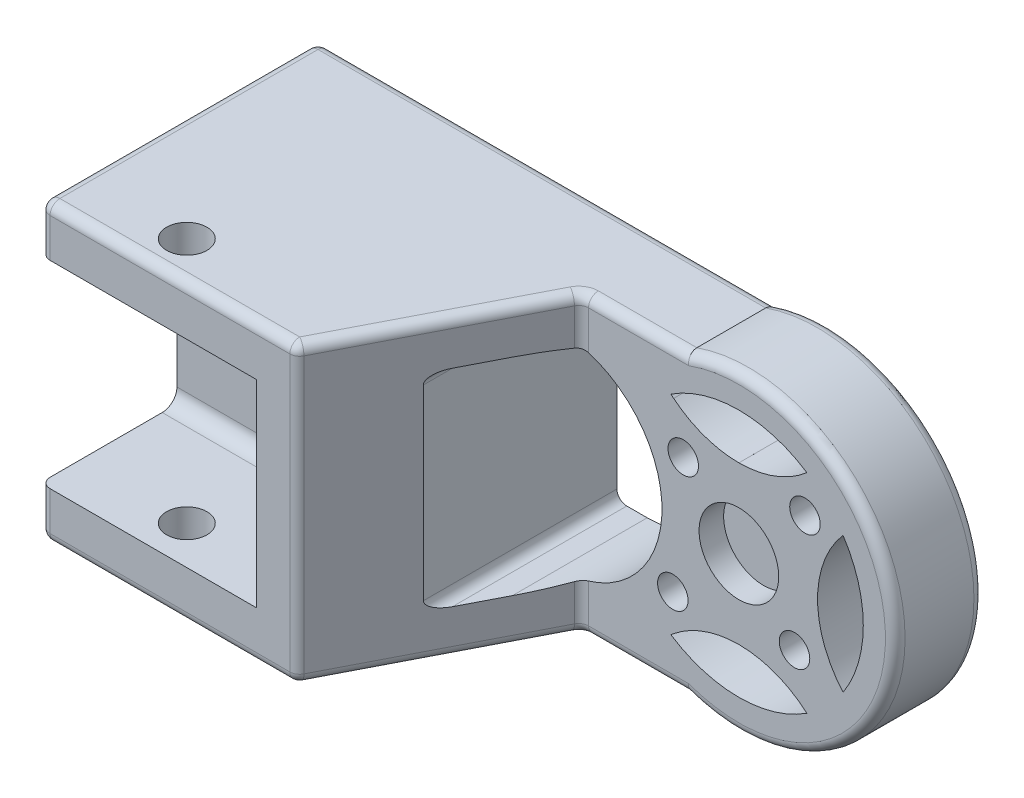
from build123d import *

# Parameters (mm, degrees)
ESQUISSE4_R                   = 13.9
ESQUISSE4_R_2                 = 1.55
BOSS_EXTRU_3_DEPTH            = 4.5
ESQUISSE7_R                   = 15.9
ESQUISSE7_R_2                 = 13.9
BOSS_EXTRU_7_DEPTH            = 9
BOSS_EXTRU_8_DEPTH            = 30
ENL_V_START                   = -4.5
ENL_V_MAT_EXTRU_12_OUTLINE_R  = 1.55
ENL_V_MAT_EXTRU_12_DEPTH      = 9
TROU_TARAUD_M32_D             = 2.5
TROU_TARAUD_M32_DEPTH         = 36
TROU_TARAUD_M32_CSINK_D       = 3.5
TROU_TARAUD_M32_CSINK_ANGLE   = 90
ENL_V_MAT_EXTRU_1_DEPTH       = 22
ESQUISSE13_R                  = 2.05
ENL_V_MAT_EXTRU_4_DEPTH       = 69.045108798
ESQUISSE15_R                  = 2.05
ENL_V_MAT_EXTRU_5_DEPTH       = 66.052954056
ENL_V_MAT_EXTRU_6_DEPTH       = 77.342234353
ESQUISSE24_R                  = 4.05
ENL_V_MAT_EXTRU_9_DEPTH       = 2.5
TROU_TARAUD_M33_D             = 2.5
TROU_TARAUD_M33_DEPTH         = 28.24245014
TROU_TARAUD_M33_CSINK_D       = 3.5
TROU_TARAUD_M33_CSINK_ANGLE   = 90
CONG_2_R                      = 1
ENL_V_MAT_EXTRU_13_DEPTH      = 58.499206362
ENL_V_MAT_EXTRU_13_DEPTH_BACK = 58.499206362
CONG_3_R                      = 1
CONG_4_R                      = 1


# Read off the part's stored shape, not the designer's step: Enlèv. mat.-Extru.12
with BuildPart() as part:
    # Esquisse4 → Boss.-Extru.3 (new, symmetric)
    with BuildSketch(Plane.XY):
        Circle(ESQUISSE4_R)
        with Locations((-6.717514421, -6.717514421)):
            Circle(ESQUISSE4_R_2, mode=Mode.SUBTRACT)
        with Locations((6.717514421, 6.717514421)):
            Circle(ESQUISSE4_R_2, mode=Mode.SUBTRACT)
        with Locations((-5.656854249, 5.656854249)):
            Circle(ESQUISSE4_R_2, mode=Mode.SUBTRACT)
        with Locations((5.656854249, -5.656854249)):
            Circle(ESQUISSE4_R_2, mode=Mode.SUBTRACT)
        with BuildLine():
            ThreePointArc((-10.594734512, 6.911881121), (-12.65, 0), (-10.594734512, -6.911881121))
            ThreePointArc((-10.594734512, -6.911881121), (-7.999175124, 0), (-10.594734512, 6.911881121))
        make_face(mode=Mode.SUBTRACT)
        with BuildLine():
            ThreePointArc((6.911881121, -10.594734512), (0, -7.999175124), (-6.911881121, -10.594734512))
            ThreePointArc((-6.911881121, -10.594734512), (0, -12.65), (6.911881121, -10.594734512))
        make_face(mode=Mode.SUBTRACT)
        with BuildLine():
            ThreePointArc((-6.911881121, 10.594734512), (0, 7.999175124), (6.911881121, 10.594734512))
            ThreePointArc((6.911881121, 10.594734512), (0, 12.65), (-6.911881121, 10.594734512))
        make_face(mode=Mode.SUBTRACT)
        with BuildLine():
            ThreePointArc((10.594734512, 6.911881121), (7.999175124, 0), (10.594734512, -6.911881121))
            ThreePointArc((10.594734512, -6.911881121), (12.65, 0), (10.594734512, 6.911881121))
        make_face(mode=Mode.SUBTRACT)
    extrude(amount=BOSS_EXTRU_3_DEPTH, both=True)

    # Esquisse7 → Boss.-Extru.7 (add)
    with BuildSketch(Plane.XY.offset(4.5)):
        Circle(ESQUISSE7_R)
        Circle(ESQUISSE7_R_2, mode=Mode.SUBTRACT)
    extrude(amount=-BOSS_EXTRU_7_DEPTH)

    # Esquisse6 → Boss.-Extru.8 (add)
    with BuildSketch(Plane(origin=(0, -15, 0), x_dir=(1, 0, 0), z_dir=(0, 1, 0))):
        Polygon((-51.798424989, -31.5), (-29.798424989, -31.5), (-15.9, -4.5), (0, -4.5), (0, 4.5), (-15.9, 4.5), (-51.798424989, 4.5), align=None)
    extrude(amount=BOSS_EXTRU_8_DEPTH)

    # Enlèv. mat.-Extru.12 outline → Enlèv. mat.-Extru.12 (cut)
    with BuildSketch(Plane.XY.offset(ENL_V_START)):
        with BuildLine():
            ThreePointArc((0, 12.65), (-3.605489456, 12.125301884), (-6.911881121, 10.594734512))
            ThreePointArc((-6.911881121, 10.594734512), (-6.773099648, 10.475509721), (-6.632262004, 10.358720998))
            ThreePointArc((-6.632262004, 10.358720998), (-6.631896353, 10.3589551), (-6.631530694, 10.359189189))
            ThreePointArc((-6.631530694, 10.359189189), (-3.519338467, 8.607363508), (0, 8))
            Line((0, 8), (0, 12.65))
        make_face()
        with BuildLine():
            ThreePointArc((-6.911881121, -10.594734512), (-3.605489456, -12.125301884), (0, -12.65))
            Line((0, -12.65), (0, -8))
            ThreePointArc((0, -8), (-3.519338467, -8.607363508), (-6.631530694, -10.359189189))
            ThreePointArc((-6.631530694, -10.359189189), (-6.631896353, -10.3589551), (-6.632262004, -10.358720998))
            ThreePointArc((-6.632262004, -10.358720998), (-6.773099648, -10.475509721), (-6.911881121, -10.594734512))
        make_face()
        with BuildLine():
            ThreePointArc((-10.358720998, 6.632262004), (-10.475509721, 6.773099648), (-10.594734512, 6.911881121))
            ThreePointArc((-10.594734512, 6.911881121), (-12.65, 0), (-10.594734512, -6.911881121))
            ThreePointArc((-10.594734512, -6.911881121), (-10.475509721, -6.773099648), (-10.358720998, -6.632262004))
            ThreePointArc((-10.358720998, -6.632262004), (-10.3589551, -6.631896353), (-10.359189189, -6.631530694))
            ThreePointArc((-10.359189189, -6.631530694), (-8, 0), (-10.359189189, 6.631530694))
            ThreePointArc((-10.359189189, 6.631530694), (-10.3589551, 6.631896353), (-10.358720998, 6.632262004))
        make_face()
        with Locations((-6.717514421, -6.717514421)):
            Circle(ENL_V_MAT_EXTRU_12_OUTLINE_R)
        with Locations((-5.656854249, 5.656854249)):
            Circle(ENL_V_MAT_EXTRU_12_OUTLINE_R)
    extrude(amount=ENL_V_MAT_EXTRU_12_DEPTH, mode=Mode.SUBTRACT)

    # Trou taraudé M32
    with Locations(Plane(origin=(5.656854249, -5.656854249, -4.5), x_dir=(-1, 0, 0), z_dir=(0, 0, -1))):
        with Locations((0, 0), (-1.060660172, 12.37436867)):
            CounterSinkHole(TROU_TARAUD_M32_D / 2, TROU_TARAUD_M32_CSINK_D / 2, depth=TROU_TARAUD_M32_DEPTH, counter_sink_angle=TROU_TARAUD_M32_CSINK_ANGLE)

    # Esquisse8 → Enlèv. mat.-Extru.1 (cut)
    with BuildSketch(Plane.ZY.offset(51.798424989)):
        with BuildLine():
            Line((28.34, 10.05), (11.34, 10.05))
            ThreePointArc((11.34, 10.05), (10.279339828, 9.610660172), (9.84, 8.55))
            Line((9.84, 8.55), (9.84, -8.55))
            ThreePointArc((9.84, -8.55), (10.279339828, -9.610660172), (11.34, -10.05))
            Line((11.34, -10.05), (28.34, -10.05))
            ThreePointArc((28.34, -10.05), (29.400660172, -9.610660172), (29.84, -8.55))
            Line((29.84, -8.55), (29.84, 8.55))
            ThreePointArc((29.84, 8.55), (29.400660172, 9.610660172), (28.34, 10.05))
        make_face()
    extrude(amount=-ENL_V_MAT_EXTRU_1_DEPTH, mode=Mode.SUBTRACT)

    # Esquisse13 → Enlèv. mat.-Extru.4 (cut, through all)
    with BuildSketch(Plane.XZ.offset(15)):
        with Locations(Location((-40.798424989, 19.84, 0), (0, 0, 270))):
            Circle(ESQUISSE13_R)
    extrude(amount=-ENL_V_MAT_EXTRU_4_DEPTH, mode=Mode.SUBTRACT)

    # Esquisse15 → Enlèv. mat.-Extru.5 (cut, through all)
    with BuildSketch(Plane(origin=(0, 0, -4.5), x_dir=(-1, 0, 0), z_dir=(0, 0, -1))):
        with Locations((40.798424989, 0)):
            Circle(ESQUISSE15_R)
    extrude(amount=-ENL_V_MAT_EXTRU_5_DEPTH, mode=Mode.SUBTRACT)

    # Esquisse16 → Enlèv. mat.-Extru.6 (cut, through all)
    with BuildSketch(Plane.ZY.offset(51.798424989)):
        Polygon((23.74245014, 10.05), (23.74245014, -10.05), (23.74245014, -15), (31.5, -15), (31.5, 15), (23.74245014, 15), align=None)
    extrude(amount=-ENL_V_MAT_EXTRU_6_DEPTH, mode=Mode.SUBTRACT)

    # Esquisse24 → Enlèv. mat.-Extru.9 (cut)
    with BuildSketch(Plane.XY.offset(4.5)):
        Circle(ESQUISSE24_R)
    extrude(amount=-ENL_V_MAT_EXTRU_9_DEPTH, mode=Mode.SUBTRACT)

    # Trou taraudé M33
    with Locations(Plane(origin=(0, 0, -4.5), x_dir=(-1, 0, 0), z_dir=(0, 0, -1))):
        with Locations((6.717514421, -6.717514421), (5.656854249, 5.656854249)):
            CounterSinkHole(TROU_TARAUD_M33_D / 2, TROU_TARAUD_M33_CSINK_D / 2, depth=TROU_TARAUD_M33_DEPTH, counter_sink_angle=TROU_TARAUD_M33_CSINK_ANGLE)

    # Congé2
    cong_2_edges = [part.edges().sort_by_distance(p)[0] for p in [
        (-20.852587961, -15, 14.12122507),
        (-20.852587961, 15, 14.12122507),
        (-38.801800455, 15, 23.74245014),
        (-25.805175921, 0, 23.74245014),
        (-38.801800455, -15, 23.74245014),
        (15.9, 0, -4.5),
        (15.9, 0, 4.5),
        (-15.9, 0, 4.5),
        (-10.586759375, -15, 4.5),
        (-28.535971869, -15, -4.5),
        (-51.798424989, 0, -4.5),
        (-28.535971869, 15, -4.5),
        (-10.586759375, 15, 4.5),
    ]]
    fillet(cong_2_edges, radius=CONG_2_R)

    # Esquisse27 → Enlèv. mat.-Extru.13 (cut, two sides: drawn at the far end of the back side and taken through both)
    with BuildSketch(Plane.XY.offset(4.5).offset(-ENL_V_MAT_EXTRU_13_DEPTH_BACK)):
        with BuildLine():
            Line((-18.31885198, -10.5), (-21.396528806, -10.5))
            Line((-21.396528806, -10.5), (-21.396528806, 10.5))
            Line((-21.396528806, 10.5), (-18.31885198, 10.5))
            ThreePointArc((-18.31885198, 10.5), (-7.81885198, 0), (-18.31885198, -10.5))
        make_face()
    extrude(amount=ENL_V_MAT_EXTRU_13_DEPTH + ENL_V_MAT_EXTRU_13_DEPTH_BACK, mode=Mode.SUBTRACT)

    # Congé3
    cong_3_edges = [part.edges().sort_by_distance(p)[0] for p in [
        (-21.396528806, 10.5, 5.338960274),
        (-21.396528806, -10.5, 5.338960274),
    ]]
    fillet(cong_3_edges, radius=CONG_3_R)

    # Congé4
    # the kernel refuses this fillet: 1 mm, written as the material it takes off along each edge
    with BuildSketch(Plane(origin=(-50.798424989, 14, -3.5), x_dir=(-1, 0, 0), z_dir=(0, 1, 0))) as cong_4_piece_1_section:
        Polygon((0, 0), (CONG_4_R, 0), (CONG_4_R, -CONG_4_R), (0, -CONG_4_R), align=None)
    cong_4_piece_1 = extrude(amount=CONG_4_R, mode=Mode.PRIVATE)
    cong_4_piece_1 = cong_4_piece_1 - Plane(origin=(-50.798424989, 14, -3.5), x_dir=(0.7071067811865477, 0, 0.7071067811865475), z_dir=(0, 1, 0)) * Sphere(CONG_4_R, mode=Mode.PRIVATE)
    add(cong_4_piece_1, mode=Mode.SUBTRACT)
    with BuildSketch(Plane(origin=(-50.798424989, -14, -3.5), x_dir=(-1, 0, 0), z_dir=(0, -1, 0))) as cong_4_piece_2_section:
        Polygon((0, 0), (CONG_4_R, 0), (CONG_4_R, CONG_4_R), (0, CONG_4_R), align=None)
    cong_4_piece_2 = extrude(amount=CONG_4_R, mode=Mode.PRIVATE)
    cong_4_piece_2 = cong_4_piece_2 - Plane(origin=(-50.798424989, -14, -3.5), x_dir=(0.7071067811865477, 0, 0.7071067811865475), z_dir=(0, -1, 0)) * Sphere(CONG_4_R, mode=Mode.PRIVATE)
    add(cong_4_piece_2, mode=Mode.SUBTRACT)
    with BuildSketch(Plane(origin=(-51.798424989, -14, 23.74245014), x_dir=(1, 0, 0), z_dir=(0, 1, 0)), Plane(origin=(-51.798424989, 7.55, 23.74245014), x_dir=(1, 0, 0), z_dir=(0, 1, 0))) as cong_4_piece_3:
        with BuildLine():
            CenterArc((CONG_4_R, CONG_4_R), CONG_4_R, 180, 90)
            Line((0, CONG_4_R), (0, 0))
            Line((0, 0), (CONG_4_R, 0))
        make_face()
    extrude(amount=6.45, mode=Mode.SUBTRACT)
    with BuildSketch(Plane(origin=(-51.798424989, -15, -3.5), x_dir=(1, 0, 0), z_dir=(0, 0, 1))) as cong_4_piece_4:
        with BuildLine():
            CenterArc((CONG_4_R, CONG_4_R), CONG_4_R, 180, 90)
            Line((0, CONG_4_R), (0, 0))
            Line((0, 0), (CONG_4_R, 0))
        make_face()
    extrude(amount=26.24245014, mode=Mode.SUBTRACT)
    with BuildSketch(Plane(origin=(-51.798424989, 15, -3.5), x_dir=(1, 0, 0), z_dir=(0, 0, 1))) as cong_4_piece_5:
        with BuildLine():
            CenterArc((CONG_4_R, -CONG_4_R), CONG_4_R, 90, 90)
            Line((0, -CONG_4_R), (0, 0))
            Line((0, 0), (CONG_4_R, 0))
        make_face()
    extrude(amount=26.24245014, mode=Mode.SUBTRACT)
    with BuildSketch(Plane(origin=(-51.798424989, 14, 22.74245014), x_dir=(0, 0, 1), z_dir=(0, -1, 0))) as cong_4_piece_6:
        with BuildLine():
            CenterArc((1 - CONG_4_R, -CONG_4_R), CONG_4_R, 0, 90)
            Line((1, -CONG_4_R), (1, 0))
            Line((1, 0), (1 - CONG_4_R, 0))
        make_face()
    revolve(axis=Axis((-51.798424989, 14, 22.74245014), (-1, 0, 0)), revolution_arc=90, mode=Mode.SUBTRACT)
    with BuildSketch(Plane(origin=(-51.798424989, -14, 22.74245014), x_dir=(0, 0, 1), z_dir=(0, 1, 0))) as cong_4_piece_7:
        with BuildLine():
            CenterArc((1 - CONG_4_R, CONG_4_R), CONG_4_R, 270, 90)
            Line((1 - CONG_4_R, 0), (1, 0))
            Line((1, 0), (1, CONG_4_R))
        make_face()
    revolve(axis=Axis((-51.798424989, -14, 22.74245014), (1, 0, 0)), revolution_arc=90, mode=Mode.SUBTRACT)


solid = part.part
